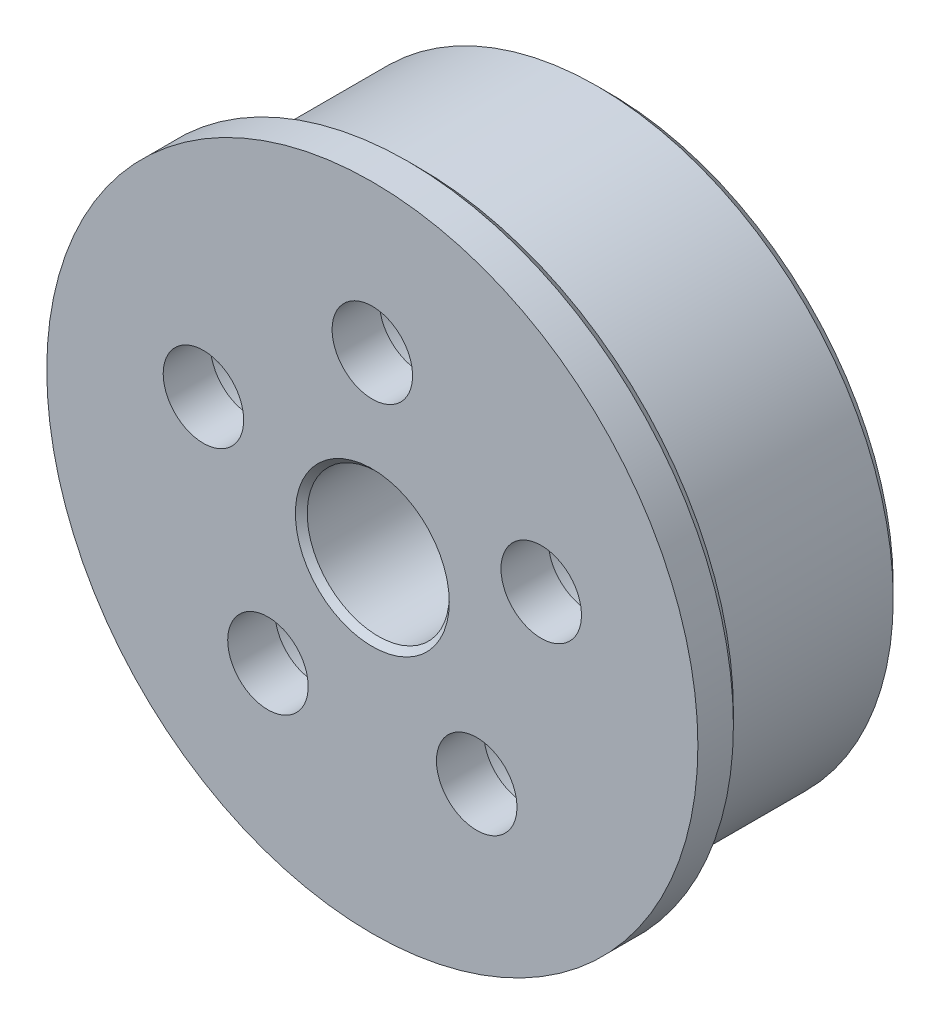
from build123d import *

# Parameters (mm, degrees)
SKETCH_1_R                   = 12.5
SKETCH_1_R_2                 = 1.5
EXTRUDE_1_DEPTH              = 10
EXTRUDE_START                = -2
SKETCH_3_R                   = 13.75
SKETCH_3_R_2                 = 12.5
EXTRUDE_3_DEPTH              = 2
SKETCH_4_R                   = 3
CUT_EXTRUDE_1_DEPTH          = 22.866069606
HOLE_WIZARD_M3_1_D           = 3.4
HOLE_WIZARD_M3_1_CBORE_D     = 7
HOLE_WIZARD_M3_1_CBORE_DEPTH = 8
CHAMFER_1_SIZE               = 0.5
CHAMFER_2_SIZE               = 0.25


with BuildPart() as part:
    # ｽｹｯﾁ1 → ﾎﾞｽ - 押し出し1 (new body)
    with BuildSketch(Plane.XY):
        Circle(SKETCH_1_R)
        with Locations((0, 7.5)):
            Circle(SKETCH_1_R_2, mode=Mode.SUBTRACT)
        with Locations((7.132923872, 2.317627458)):
            Circle(SKETCH_1_R_2, mode=Mode.SUBTRACT)
        with Locations((4.408389392, -6.067627458)):
            Circle(SKETCH_1_R_2, mode=Mode.SUBTRACT)
        with Locations((-4.408389392, -6.067627458)):
            Circle(SKETCH_1_R_2, mode=Mode.SUBTRACT)
        with Locations((-7.132923872, 2.317627458)):
            Circle(SKETCH_1_R_2, mode=Mode.SUBTRACT)
    extrude(amount=EXTRUDE_1_DEPTH)

    # ｽｹｯﾁ3 → ﾎﾞｽ - 押し出し3 (add)
    with BuildSketch(Plane.XY.offset(10).offset(EXTRUDE_START)):
        Circle(SKETCH_3_R)
        Circle(SKETCH_3_R_2, mode=Mode.SUBTRACT)
    extrude(amount=EXTRUDE_3_DEPTH)

    # ｽｹｯﾁ4 → ｶｯﾄ - 押し出し1 (cut, through all)
    with BuildSketch(Plane(origin=(0, 0, 0), x_dir=(-1, 0, 0), z_dir=(0, 0, -1))):
        Circle(SKETCH_4_R)
    extrude(amount=-CUT_EXTRUDE_1_DEPTH, mode=Mode.SUBTRACT)

    # M3 穴付きねじ用座ぐり穴1 (through all)
    with Locations(Plane(origin=(0, 0, 0), x_dir=(-1, 0, 0), z_dir=(0, 0, -1))):
        with Locations((0, 7.5), (7.132923872, 2.317627458), (4.408389392, -6.067627458), (-4.408389392, -6.067627458), (-7.132923872, 2.317627458)):
            CounterBoreHole(HOLE_WIZARD_M3_1_D / 2, HOLE_WIZARD_M3_1_CBORE_D / 2, HOLE_WIZARD_M3_1_CBORE_DEPTH)

    # 面取り1
    chamfer_1_edges = [part.edges().sort_by_distance(p)[0] for p in [
        (-12.5, 0, 0),
        (-13.75, 0, 8),
    ]]
    chamfer(chamfer_1_edges, length=CHAMFER_1_SIZE)

    # 面取り2
    chamfer_2_edges = [part.edges().sort_by_distance(p)[0] for p in [
        (3, 0, 0),
        (3, 0, 10),
        (7.908389392, -6.067627458, 0),
        (-0.908389392, -6.067627458, 0),
        (-3.632923872, 2.317627458, 0),
        (3.5, 7.5, 0),
        (10.632923872, 2.317627458, 0),
    ]]
    chamfer(chamfer_2_edges, length=CHAMFER_2_SIZE)


solid = part.part
